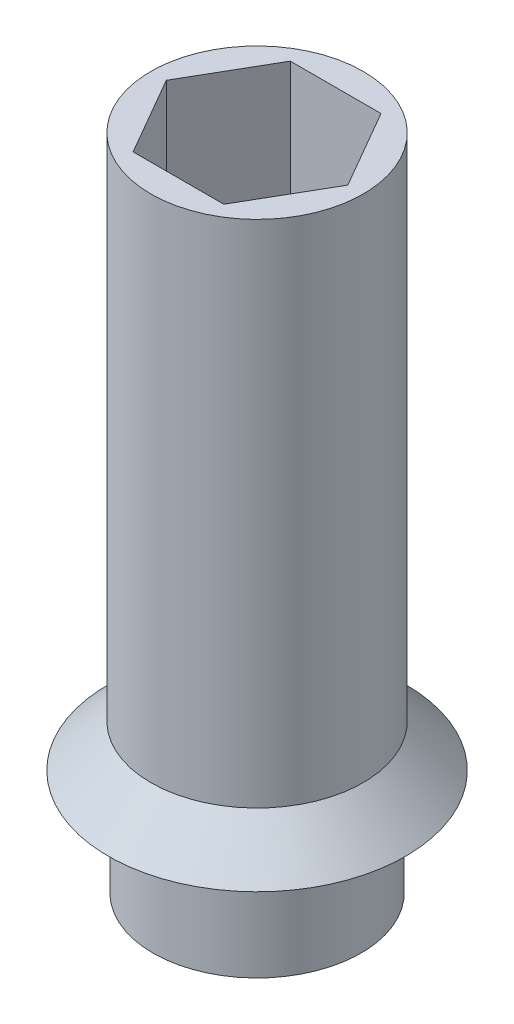
from build123d import *

# Parameters (mm, degrees)
SKETCH_1_R      = 4.9
EXTRUDE_1_DEPTH = 5
SKETCH_2_R      = 5
EXTRUDE_2_DEPTH = 26
SKETCH_5_R      = 7
SKETCH_5_R_2    = 5
EXTRUDE_4_DEPTH = 2
CHAMFER_1_SIZE  = 2


with BuildPart() as part:
    # 草图1 → 凸台-拉伸1 (new body)
    with BuildSketch(Plane(origin=(0, 0, 0), x_dir=(1, 0, 0), z_dir=(0, 1, 0))):
        with Locations(Location((0, 0, 0), (0, 0, 270))):
            Circle(SKETCH_1_R)
        Polygon((4.272391992, 0), (2.136195996, 3.7), (-2.136195996, 3.7), (-4.272391992, 0), (-2.136195996, -3.7), (2.136195996, -3.7), align=None, mode=Mode.SUBTRACT)
    extrude(amount=EXTRUDE_1_DEPTH)

    # 草图2 → 凸台-拉伸2 (add)
    with BuildSketch(Plane(origin=(0, 5, 0), x_dir=(1, 0, 0), z_dir=(0, 1, 0))):
        with Locations(Location((0, 0, 0), (0, 0, 90))):
            Circle(SKETCH_2_R)
        Polygon((4.272391992, 0), (2.136195996, 3.7), (-2.136195996, 3.7), (-4.272391992, 0), (-2.136195996, -3.7), (2.136195996, -3.7), align=None, mode=Mode.SUBTRACT)
    extrude(amount=EXTRUDE_2_DEPTH)

    # 草图5 → 凸台-拉伸4 (add)
    with BuildSketch(Plane.XZ.offset(-5)):
        with Locations(Location((0, 0, 0), (0, 0, 270))):
            Circle(SKETCH_5_R)
        with Locations(Location((0, 0, 0), (0, 0, 270))):
            Circle(SKETCH_5_R_2, mode=Mode.SUBTRACT)
    extrude(amount=-EXTRUDE_4_DEPTH)

    # 倒角1
    chamfer_1_edges = [part.edges().sort_by_distance(p)[0] for p in [
        (0, 7, 7),
    ]]
    chamfer(chamfer_1_edges, length=CHAMFER_1_SIZE - 0.0001)  # a hair under: the kernel refuses the full size


solid = part.part
